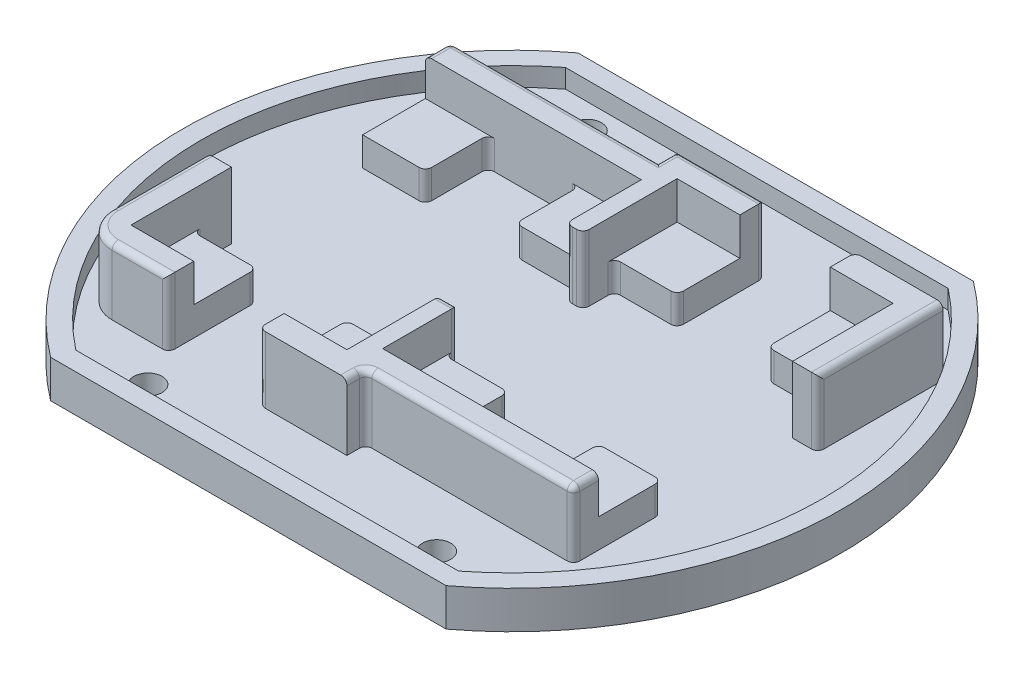
from build123d import *

# Parameters (mm, degrees)
A_BASE_T42_OUTLINE_R       = 2.2479
A_BASE_T42_OUTLINE_R_2     = 1
A_BASE_T42_DEPTH           = 3
OUTER_BRIM_DEPTH           = 3
SKETCH5_W                  = 15
SKETCH5_H                  = 3
BASE_SUPPORTS_DEPTH        = 3
BASE_SUPPORTS_CHAMFER_SIZE = 3
COVER_START                = -3
SKETCH6_R                  = 1
COVER_DEPTH                = 3
SKETCH9_W                  = 15
SKETCH9_H                  = 6
CUT_EXTRUDE1_DEPTH         = 10
SKETCH11_W                 = 10
SKETCH11_H                 = 10
BOSS_EXTRUDE1_DEPTH        = 4.6
BOSS_EXTRUDE2_DEPTH        = 10.6
FILLET1_R                  = 1
FILLET2_R                  = 5


# Read off the part's stored shape, not the designer's step: a_base_t42
# Some blends are built 0.0001 mm under size
with BuildPart() as part:
    # a_base_t42 outline → a_base_t42 (new body)
    with BuildSketch(Plane(origin=(0, 0, 0), x_dir=(1, 0, 0), z_dir=(0, 1, 0))):
        with BuildLine():
            ThreePointArc((31.5, -42), (52.5, 0), (31.5, 42))
            Line((31.5, 42), (-31.5, 42))
            ThreePointArc((-31.5, 42), (-52.5, 0), (-31.5, -42))
            Line((-31.5, -42), (31.5, -42))
        make_face()
        with Locations((-23, -35)):
            Circle(A_BASE_T42_OUTLINE_R, mode=Mode.SUBTRACT)
        with Locations((23, -35)):
            Circle(A_BASE_T42_OUTLINE_R, mode=Mode.SUBTRACT)
        with Locations((-40.25, 0)):
            Circle(A_BASE_T42_OUTLINE_R_2, mode=Mode.SUBTRACT)
        with Locations((-23, 35)):
            Circle(A_BASE_T42_OUTLINE_R, mode=Mode.SUBTRACT)
        with Locations((40.25, 0)):
            Circle(A_BASE_T42_OUTLINE_R_2, mode=Mode.SUBTRACT)
        with Locations((23, 35)):
            Circle(A_BASE_T42_OUTLINE_R, mode=Mode.SUBTRACT)
    extrude(amount=A_BASE_T42_DEPTH)

    # Sketch1 → Outer Brim (add)
    with BuildSketch(Plane(origin=(0, 3, 0), x_dir=(1, 0, 0), z_dir=(0, 1, 0))):
        with BuildLine():
            Line((-31.5, -42), (31.5, -42))
            ThreePointArc((31.5, -42), (52.5, 0), (31.5, 42))
            Line((31.5, 42), (-31.5, 42))
            ThreePointArc((-31.5, 42), (-52.5, 0), (-31.5, -42))
        make_face()
        with BuildLine():
            Line((30.483602149, 39), (-30.483602149, 39))
            ThreePointArc((-30.483602149, 39), (-49.5, 0), (-30.483602149, -39))
            Line((-30.483602149, -39), (30.483602149, -39))
            ThreePointArc((30.483602149, -39), (49.5, 0), (30.483602149, 39))
        make_face(mode=Mode.SUBTRACT)
    extrude(amount=OUTER_BRIM_DEPTH)

    # Sketch5 → Base Supports (add)
    with BuildSketch(Plane(origin=(0, 3, 0), x_dir=(1, 0, 0), z_dir=(0, 1, 0))):
        with Locations((0, -27)):
            Rectangle(SKETCH5_W, SKETCH5_H)
        with Locations((0, 27)):
            Rectangle(SKETCH5_W, SKETCH5_H)
    extrude(amount=BASE_SUPPORTS_DEPTH)

    # Base Supports Chamfer
    base_supports_chamfer_edges = [part.edges().sort_by_distance(p)[0] for p in [
        (0, 3, 28.5),
        (0, 3, -28.5),
    ]]
    chamfer(base_supports_chamfer_edges, length=BASE_SUPPORTS_CHAMFER_SIZE - 0.0001)  # a hair under: the kernel refuses the full size

    # Sketch6 → Cover (add)
    with BuildSketch(Plane(origin=(0, 3, 0), x_dir=(1, 0, 0), z_dir=(0, 1, 0)).offset(COVER_START)):
        with Locations((-40.25, 0)):
            Circle(SKETCH6_R)
        with Locations((40.25, 0)):
            Circle(SKETCH6_R)
    extrude(amount=COVER_DEPTH)

    # Sketch9 → Cut-Extrude1 (cut)
    with BuildSketch(Plane(origin=(0, 3, 0), x_dir=(1, 0, 0), z_dir=(0, 1, 0))):
        with Locations((0, 28.5)):
            Rectangle(SKETCH9_W, SKETCH9_H)
        with Locations((0, -28.5)):
            Rectangle(SKETCH9_W, SKETCH9_H)
    extrude(amount=CUT_EXTRUDE1_DEPTH, mode=Mode.SUBTRACT)

    # Sketch11 → Boss-Extrude1 (add)
    with BuildSketch(Plane(origin=(5.553919153, 3, -19.484186112), x_dir=(-1, 0, 0), z_dir=(0, 1, 0))):
        with Locations((11.903919153, 39.434186112)):
            Rectangle(SKETCH11_W, SKETCH11_H)
        with Locations((36.303919153, 39.434186112)):
            Rectangle(SKETCH11_W, SKETCH11_H)
        with Locations((36.303919153, 2.534186112)):
            Rectangle(SKETCH11_W, SKETCH11_H)
        with Locations((11.903919153, 2.534186112)):
            Rectangle(SKETCH11_W, SKETCH11_H)
        with Locations((-0.796080847, -0.465813888)):
            Rectangle(SKETCH11_W, SKETCH11_H)
        with Locations((-0.796080847, 36.434186112)):
            Rectangle(SKETCH11_W, SKETCH11_H)
        with Locations((-25.196080847, 36.434186112)):
            Rectangle(SKETCH11_W, SKETCH11_H)
        with Locations((-25.196080847, -0.465813888)):
            Rectangle(SKETCH11_W, SKETCH11_H)
    extrude(amount=BOSS_EXTRUDE1_DEPTH)

    # Sketch13 → Boss-Extrude2 (add)
    with BuildSketch(Plane(origin=(5.553919153, 3, -19.484186112), x_dir=(-1, 0, 0), z_dir=(0, 1, 0))):
        Polygon((2.903919153, 48.434186112), (2.903919153, 45.434186112), (-30.196080847, 45.434186112), (-30.196080847, 41.434186112), (4.203919153, 41.434186112), (4.203919153, 29.434186112), (6.903919153, 29.434186112), (6.903919153, 44.434186112), (16.903919153, 44.434186112), (16.903919153, 48.434186112), align=None)
        Polygon((41.303919153, -2.465813888), (41.303919153, -6.465813888), (8.203919153, -6.465813888), (8.203919153, -9.465813888), (-5.796080847, -9.465813888), (-5.796080847, -5.465813888), (4.203919153, -5.465813888), (4.203919153, 9.534186112), (6.903919153, 9.534186112), (6.903919153, -2.465813888), align=None)
        Polygon((41.303919153, 44.434186112), (41.303919153, 28.434186112), (45.303919153, 28.434186112), (45.303919153, 48.434186112), (31.303919153, 48.434186112), (31.303919153, 44.434186112), align=None)
        Polygon((-34.196080847, -9.465813888), (-34.196080847, 10.534186112), (-30.196080847, 10.534186112), (-30.196080847, -5.465813888), (-20.196080847, -5.465813888), (-20.196080847, -9.465813888), align=None)
    extrude(amount=BOSS_EXTRUDE2_DEPTH)

    # Fillet1
    fillet1_edges = [part.edges().sort_by_distance(p)[0] for p in [
        (11.35, 5.3, 11.95),
        (25.75, 5.3, 11.95),
        (11.35, 5.3, -14.95),
        (25.75, 5.3, -14.95),
        (0, 13.6, 9.95),
        (-25.75, 5.3, 14.95),
        (-11.35, 5.3, 14.95),
        (-11.35, 5.3, -11.95),
        (-25.75, 5.3, -11.95),
        (-35.75, 5.3, 14.95),
        (1.35, 8.3, -9.95),
        (-1.35, 8.3, -9.95),
        (-1.35, 5.3, -11.95),
        (-11.35, 5.3, -21.95),
        (-25.75, 5.3, -21.95),
        (19.2, 13.6, 25.95),
        (39.75, 13.6, -18.95),
        (4.35, 13.6, -28.95),
        (-2.65, 13.6, -27.45),
        (-19.2, 13.6, -25.95),
        (-35.75, 13.6, -23.95),
        (35.75, 13.6, 23.95),
        (39.75, 8.3, -8.95),
        (11.35, 5.3, 21.95),
        (25.75, 5.3, 21.95),
        (35.75, 5.3, -14.95),
        (1.35, 5.3, 11.95),
        (1.35, 5.3, -14.95),
        (-1.35, 5.3, 14.95),
        (-1.35, 8.3, 9.95),
        (1.35, 8.3, 9.95),
        (35.75, 5.3, 11.95),
        (35.75, 8.3, 25.95),
        (2.65, 13.6, 27.45),
        (2.65, 8.3, 25.95),
        (-32.75, 13.6, 28.95),
        (-39.75, 13.6, 18.95),
        (-39.75, 8.3, 8.95),
        (-35.75, 8.3, -25.95),
        (25.75, 8.3, -28.95),
        (11.35, 8.3, -28.95),
        (-11.35, 8.3, 28.95),
        (-25.75, 8.3, 28.95),
    ]]
    fillet(fillet1_edges, radius=FILLET1_R - 0.0001)  # a hair under: the kernel refuses the full size

    # Fillet2
    # the kernel refuses this fillet: 5 mm, written as the material it takes off along each edge
    with BuildSketch(Plane(origin=(-34.75, 13.6, 23.95), x_dir=(-1, 0, 0), z_dir=(0, 0, -1))) as fillet2_piece_1:
        with BuildLine():
            CenterArc((4.0001, -0.9999), 0.9999, 0, 90)
            Line((5, -0.9999), (5, 0))
            Line((5, 0), (4.0001, 0))
        make_face()
    revolve(axis=Axis((-34.75, 13.6, 23.95), (0, 1, 0)), revolution_arc=90, mode=Mode.SUBTRACT)
    with BuildSketch(Plane(origin=(-39.75, 3, 28.95), x_dir=(0, 0, -1), z_dir=(0, 1, 0))) as fillet2_piece_2:
        with BuildLine():
            CenterArc((FILLET2_R, -FILLET2_R), FILLET2_R, 90, 90)
            Line((0, -FILLET2_R), (0, 0))
            Line((0, 0), (FILLET2_R, 0))
        make_face()
    extrude(amount=10.6, mode=Mode.SUBTRACT)


solid = part.part
